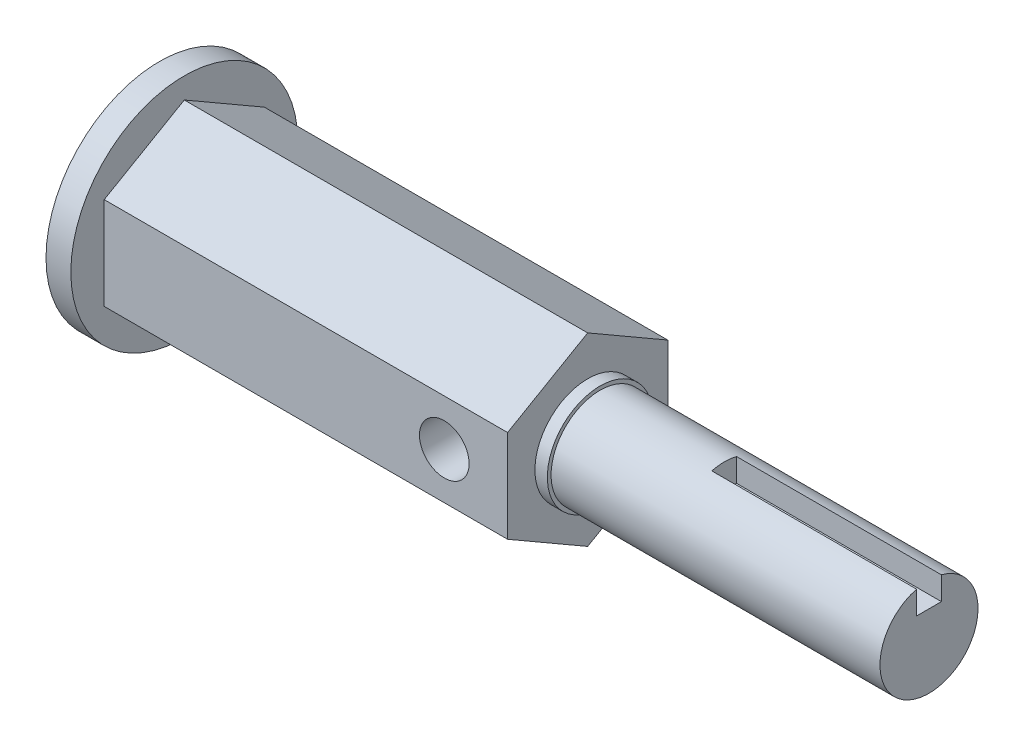
from build123d import *

# Parameters (mm, degrees)
SKETCH1_R           = 3.95
BOSS_EXTRUDE1_DEPTH = 60
SKETCH2_R           = 9.141
BOSS_EXTRUDE2_DEPTH = 2
BOSS_EXTRUDE3_DEPTH = 32.5
SKETCH4_W           = 2
SKETCH4_H           = 2
CUT_EXTRUDE1_DEPTH  = 16.5
SKETCH5_R           = 4.25
BOSS_EXTRUDE5_DEPTH = 1
SKETCH6_R           = 2
CUT_EXTRUDE2_DEPTH  = 63.663355132


with BuildPart() as part:
    # Sketch1 → Boss-Extrude1 (new body)
    with BuildSketch(Plane.YZ):
        Circle(SKETCH1_R)
    extrude(amount=BOSS_EXTRUDE1_DEPTH)

    # Sketch2 → Boss-Extrude2 (add)
    with BuildSketch(Plane(origin=(0, 0, 0), x_dir=(0, -1, 0), z_dir=(-1, 0, 0))):
        Circle(SKETCH2_R)
    extrude(amount=BOSS_EXTRUDE2_DEPTH)

    # Sketch3 → Boss-Extrude3 (add)
    with BuildSketch(Plane.YZ):
        Polygon((3.725, 6.451889258), (-3.725, 6.451889258), (-7.45, 0), (-3.725, -6.451889258), (3.725, -6.451889258), (7.45, 0), align=None)
    extrude(amount=BOSS_EXTRUDE3_DEPTH)

    # Sketch4 → Cut-Extrude1 (cut)
    with BuildSketch(Plane.YZ.offset(60)):
        with Locations((2.95, 0)):
            Rectangle(SKETCH4_W, SKETCH4_H)
    extrude(amount=-CUT_EXTRUDE1_DEPTH, mode=Mode.SUBTRACT)

    # Sketch5 → Boss-Extrude5 (add)
    with BuildSketch(Plane.YZ.offset(32.5)):
        Circle(SKETCH5_R)
    extrude(amount=BOSS_EXTRUDE5_DEPTH)

    # Sketch6 → Cut-Extrude2 (cut, through all)
    with BuildSketch(Plane(origin=(0, 0, -6.451889258), x_dir=(1, 0, 0), z_dir=(0, 0, -1))):
        with Locations((27.4, 0)):
            Circle(SKETCH6_R)
    extrude(amount=-CUT_EXTRUDE2_DEPTH, mode=Mode.SUBTRACT)


solid = part.part
